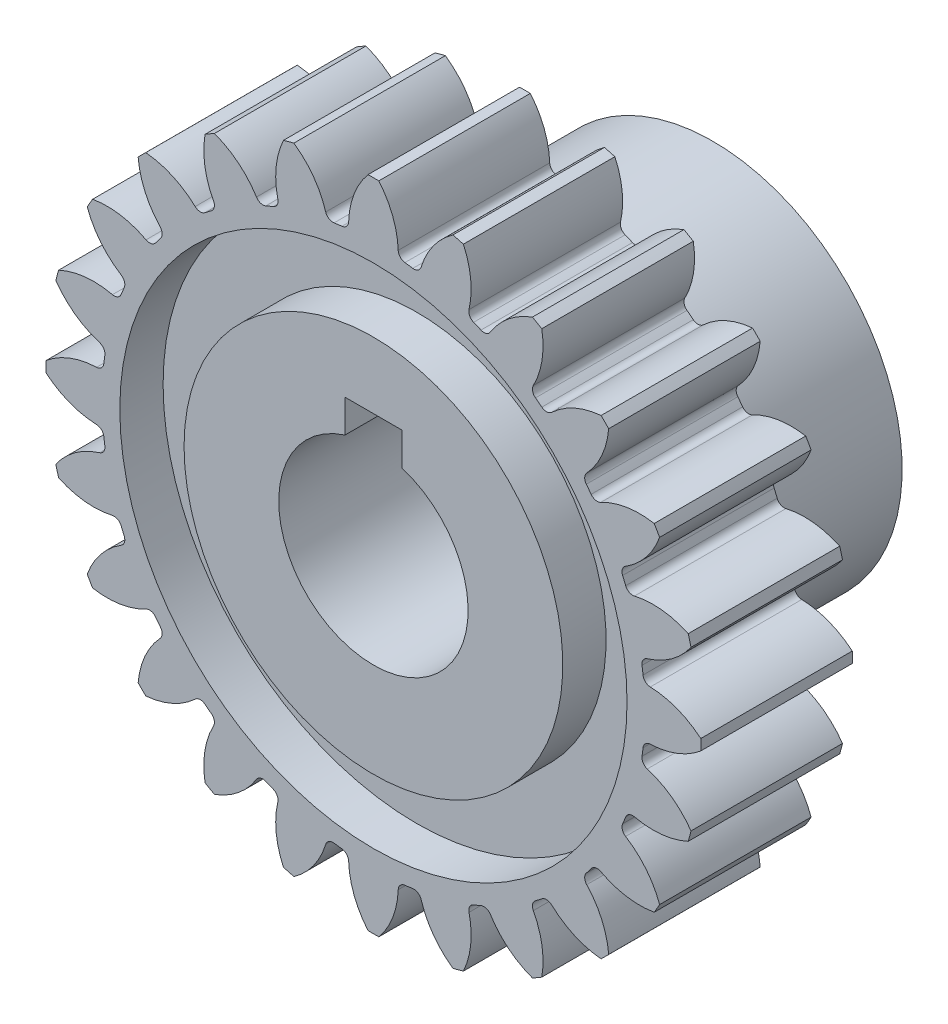
from build123d import *

# Parameters (mm, degrees)
CUT_EXTRUDE1_DEPTH = 25.060921741
CIRPATTERN1_COUNT  = 24
SKETCH5_R          = 3.175
CUT_EXTRUDE2_DEPTH = 25.060921741


with BuildPart() as part:
    # Sketch3 → Revolve1 (revolve)
    with BuildSketch(Plane(origin=(0, 0, 0), x_dir=(0, 0, -1), z_dir=(1, 0, 0))):
        Polygon((-7.112, 13.72235), (-0.762, 13.72235), (-0.762, 10.6299), (-2.576285714, 10.6299), (-2.576285714, 7.9375), (7.112, 7.9375), (7.112, 3.175), (-7.112, 3.175), (-7.112, 7.9375), (-5.297714286, 7.9375), (-5.297714286, 10.6299), (-7.112, 10.6299), align=None)
    revolve(axis=Axis((0, 0, -7.112), (0, 0, 1)))

    # Sketch4 → Cut-Extrude1 (cut, symmetric)
    with BuildSketch(Plane.XY.offset(7.112)):
        with BuildLine():
            ThreePointArc((-0.226165225, 13.7204861), (-0.809623795, 12.730495659), (-1.039023964, 11.604493643))
            ThreePointArc((-1.039023964, 11.604493643), (-1.122909631, 11.400437837), (-1.319504028, 11.300306823))
            ThreePointArc((-1.319504028, 11.300306823), (-1.485007366, 11.279750808), (-1.650191603, 11.256770978))
            ThreePointArc((-1.650191603, 11.256770978), (-1.866003022, 11.302607737), (-1.999843883, 11.477999301))
            ThreePointArc((-1.999843883, 11.477999301), (-2.512858197, 12.506260596), (-3.332664279, 13.311507741))
            ThreePointArc((-3.332664279, 13.311507741), (-1.791126094, 13.604953393), (-0.226165225, 13.7204861))
        make_face()
    cut_extrude1 = extrude(amount=CUT_EXTRUDE1_DEPTH, both=True, mode=Mode.SUBTRACT)

    # CirPattern1: Cut-Extrude1 ×24 about axis
    cirpattern1_axis = Axis((0, 0, -7.112), (0, 0, -1))
    for i in range(1, CIRPATTERN1_COUNT):
        add(cut_extrude1.rotate(cirpattern1_axis, i * 360 / CIRPATTERN1_COUNT), mode=Mode.SUBTRACT)

    # Sketch5 → Cut-Extrude2 (cut, through all)
    with BuildSketch(Plane(origin=(0, 0, -7.112), x_dir=(-1, 0, 0), z_dir=(0, 0, -1))):
        with BuildLine():
            Line((1.190625, 5.159375), (-1.190625, 5.159375))
            Line((-1.190625, 5.159375), (-1.190625, 3.785946206))
            ThreePointArc((-1.190625, 3.785946206), (0, -3.96875), (1.190625, 3.785946206))
            Line((1.190625, 3.785946206), (1.190625, 5.159375))
        make_face()
        Circle(SKETCH5_R, mode=Mode.SUBTRACT)
    extrude(amount=-CUT_EXTRUDE2_DEPTH, mode=Mode.SUBTRACT)


solid = part.part
